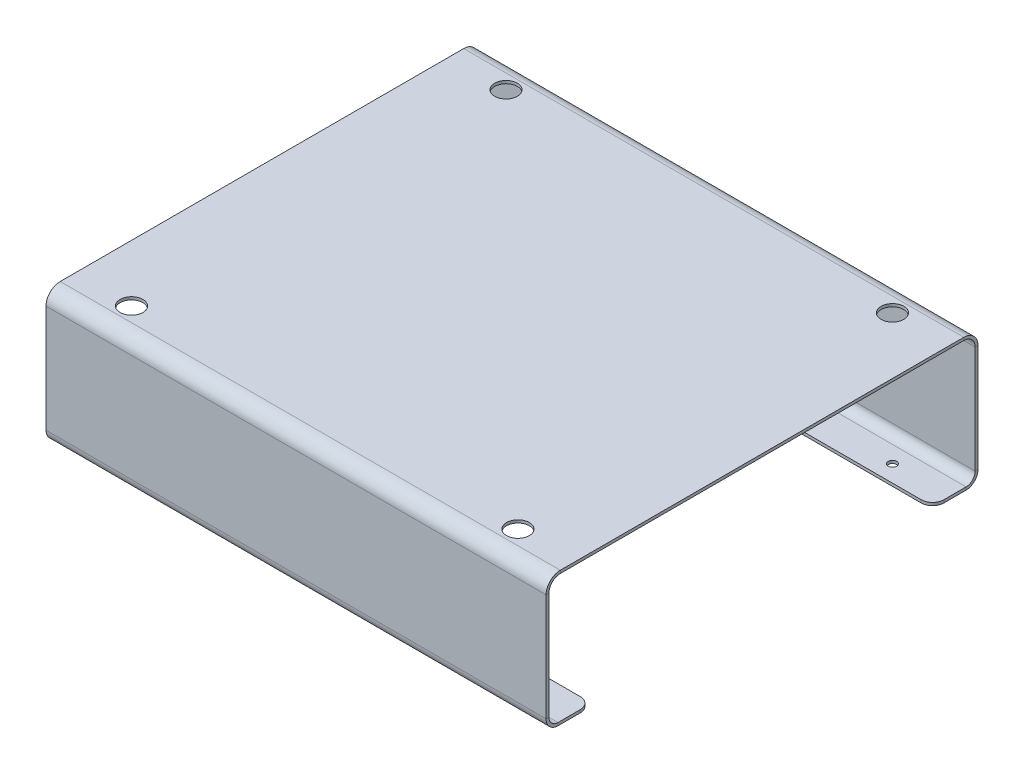
from build123d import *

# Parameters (mm, degrees)
BASE_FLANGE1_DEPTH             = 120.65
BASE_FLANGE1_DEPTH_BACK        = 120.65
SKETCH2_W                      = 279.4
SKETCH2_H                      = 1.5875
EDGE_FLANGE1_STRIP_W           = 19.05
EDGE_FLANGE1_STRIP_H           = 1.5875
EDGE_FLANGE1_STRIP_CUT_DEPTH   = 279.4
EDGE_FLANGE1_STRIP_2_W         = 19.05
EDGE_FLANGE1_STRIP_2_H         = 1.5875
EDGE_FLANGE1_STRIP_CUT_2_DEPTH = 279.4
EDGE_FLANGE1_DEPTH             = 279.4
EDGE_FLANGE1_BEND_DEPTH        = 279.4
EDGE_FLANGE2_STRIP_W           = 16.51
EDGE_FLANGE2_STRIP_H           = 1.5875
EDGE_FLANGE2_STRIP_CUT_DEPTH   = 279.4
EDGE_FLANGE2_STRIP_2_W         = 16.51
EDGE_FLANGE2_STRIP_2_H         = 1.5875
EDGE_FLANGE2_STRIP_CUT_2_DEPTH = 279.4
EDGE_FLANGE2_DEPTH             = 279.4
EDGE_FLANGE2_BEND_DEPTH        = 279.4
FILLET1_R                      = 6.35
SKETCH18_R                     = 2.38125
CUT_EXTRUDE1_DEPTH             = 200.096804736
CUT_EXTRUDE2_REACH             = 201.097
SKETCH19_R                     = 6.35


# Sheet-metal steps are written as plain solids
with BuildPart() as part:
    # Sketch2 → Base-Flange1 (new, two sides: drawn at the far end of the back side and taken through both)
    with BuildSketch(Plane.XY.offset(-BASE_FLANGE1_DEPTH_BACK)):
        with Locations((0, -0.79375)):
            Rectangle(SKETCH2_W, SKETCH2_H)
    extrude(amount=BASE_FLANGE1_DEPTH + BASE_FLANGE1_DEPTH_BACK)

    # Edge-Flange1 strip (across the edge) → Edge-Flange1 strip cut (cut)
    with BuildSketch(Plane(origin=(139.7, -1.5875, 120.65), x_dir=(0, 0, -1), z_dir=(-1, 0, 0))):
        with Locations((-1.5875, -0.79375)):
            Rectangle(EDGE_FLANGE1_STRIP_W, EDGE_FLANGE1_STRIP_H)
    extrude(amount=EDGE_FLANGE1_STRIP_CUT_DEPTH, mode=Mode.SUBTRACT)

    # Edge-Flange1 strip 2 (across the edge) → Edge-Flange1 strip cut 2 (cut)
    with BuildSketch(Plane(origin=(-139.7, -1.5875, -120.65), x_dir=(0, 0, 1), z_dir=(1, 0, 0))):
        with Locations((-1.5875, -0.79375)):
            Rectangle(EDGE_FLANGE1_STRIP_2_W, EDGE_FLANGE1_STRIP_2_H)
    extrude(amount=EDGE_FLANGE1_STRIP_CUT_2_DEPTH, mode=Mode.SUBTRACT)

    # Edge-Flange1 section (across the edge) → Edge-Flange1 (add)
    with BuildSketch(Plane(origin=(139.7, -1.5875, 120.65), x_dir=(0, 0, -1), z_dir=(-1, 0, 0))):
        with BuildLine():
            Line((0, 6.35), (0, 73.025))
            Line((0, 73.025), (1.5875, 73.025))
            Line((1.5875, 73.025), (1.5875, 6.35))
            ThreePointArc((1.5875, 6.35), (3.447371939, 1.859871939), (7.9375, 0))
            Line((7.9375, 0), (7.9375, -1.5875))
            ThreePointArc((7.9375, -1.5875), (2.324839924, 0.737339924), (0, 6.35))
        make_face()
    extrude(amount=EDGE_FLANGE1_DEPTH)

    # Edge-Flange1 section 2 (across the edge) → Edge-Flange1 bend (add)
    with BuildSketch(Plane(origin=(-139.7, -1.5875, -120.65), x_dir=(0, 0, 1), z_dir=(1, 0, 0))):
        with BuildLine():
            Line((0, 6.35), (0, 73.025))
            Line((0, 73.025), (1.5875, 73.025))
            Line((1.5875, 73.025), (1.5875, 6.35))
            ThreePointArc((1.5875, 6.35), (3.447371939, 1.859871939), (7.9375, 0))
            Line((7.9375, 0), (7.9375, -1.5875))
            ThreePointArc((7.9375, -1.5875), (2.324839924, 0.737339924), (0, 6.35))
        make_face()
    extrude(amount=EDGE_FLANGE1_BEND_DEPTH)

    # Edge-Flange2 strip (across the edge) → Edge-Flange2 strip cut (cut)
    with BuildSketch(Plane(origin=(139.7, -74.6125, 119.0625), x_dir=(0, 1, 0), z_dir=(-1, 0, 0))):
        with Locations((-1.5875, -0.79375)):
            Rectangle(EDGE_FLANGE2_STRIP_W, EDGE_FLANGE2_STRIP_H)
    extrude(amount=EDGE_FLANGE2_STRIP_CUT_DEPTH, mode=Mode.SUBTRACT)

    # Edge-Flange2 strip 2 (across the edge) → Edge-Flange2 strip cut 2 (cut)
    with BuildSketch(Plane(origin=(-139.7, -74.6125, -119.0625), x_dir=(0, 1, 0), z_dir=(1, 0, 0))):
        with Locations((-1.5875, -0.79375)):
            Rectangle(EDGE_FLANGE2_STRIP_2_W, EDGE_FLANGE2_STRIP_2_H)
    extrude(amount=EDGE_FLANGE2_STRIP_CUT_2_DEPTH, mode=Mode.SUBTRACT)

    # Edge-Flange2 section (across the edge) → Edge-Flange2 (add)
    with BuildSketch(Plane(origin=(139.7, -74.6125, 119.0625), x_dir=(0, 1, 0), z_dir=(-1, 0, 0))):
        with BuildLine():
            Line((0, 5.08), (0, 23.8125))
            Line((0, 23.8125), (1.5875, 23.8125))
            Line((1.5875, 23.8125), (1.5875, 5.08))
            ThreePointArc((1.5875, 5.08), (3.075397552, 1.487897552), (6.6675, 0))
            Line((6.6675, 0), (6.6675, -1.5875))
            ThreePointArc((6.6675, -1.5875), (1.952865536, 0.365365536), (0, 5.08))
        make_face()
    extrude(amount=EDGE_FLANGE2_DEPTH)

    # Edge-Flange2 section 2 (across the edge) → Edge-Flange2 bend (add)
    with BuildSketch(Plane(origin=(-139.7, -74.6125, -119.0625), x_dir=(0, 1, 0), z_dir=(1, 0, 0))):
        with BuildLine():
            Line((0, 5.08), (0, 23.8125))
            Line((0, 23.8125), (1.5875, 23.8125))
            Line((1.5875, 23.8125), (1.5875, 5.08))
            ThreePointArc((1.5875, 5.08), (3.075397552, 1.487897552), (6.6675, 0))
            Line((6.6675, 0), (6.6675, -1.5875))
            ThreePointArc((6.6675, -1.5875), (1.952865536, 0.365365536), (0, 5.08))
        make_face()
    extrude(amount=EDGE_FLANGE2_BEND_DEPTH)

    # Fillet1
    fillet1_edges = [part.edges().sort_by_distance(p)[0] for p in [
        (139.7, -73.81875, 95.25),
        (-139.7, -73.81875, 95.25),
        (-139.7, -73.81875, -95.25),
        (139.7, -73.81875, -95.25),
    ]]
    fillet(fillet1_edges, radius=FILLET1_R)

    # Sketch18 → Cut-Extrude1 (cut, through all)
    with BuildSketch(Plane.XZ.offset(74.6125)):
        with Locations(Location((-107.95, 104.61625, 0), (0, 0, 270))):
            Circle(SKETCH18_R)
        with Locations(Location((-107.95, -104.61625, 0), (0, 0, 270))):
            Circle(SKETCH18_R)
        with Locations(Location((107.95, -104.61625, 0), (0, 0, 270))):
            Circle(SKETCH18_R)
        with Locations(Location((107.95, 104.61625, 0), (0, 0, 270))):
            Circle(SKETCH18_R)
    extrude(amount=-CUT_EXTRUDE1_DEPTH, mode=Mode.SUBTRACT)

    # Sketch19 → Cut-Extrude2 (cut, up to next)
    with BuildSketch(Plane(origin=(0, 0, 0), x_dir=(1, 0, 0), z_dir=(0, 1, 0)), mode=Mode.PRIVATE) as cut_extrude2_sk1:
        with Locations(Location((-107.95, -104.61625, 0), (0, 0, 180))):
            Circle(SKETCH19_R)
    cut_extrude2_tool1 = extrude(cut_extrude2_sk1.sketch, amount=-CUT_EXTRUDE2_REACH, mode=Mode.PRIVATE) & part.part
    # Sketch19 → Cut-Extrude2 (cut, up to next)
    with BuildSketch(Plane(origin=(0, 0, 0), x_dir=(1, 0, 0), z_dir=(0, 1, 0)), mode=Mode.PRIVATE) as cut_extrude2_sk2:
        with Locations(Location((107.95, -104.61625, 0), (0, 0, 180))):
            Circle(SKETCH19_R)
    cut_extrude2_tool2 = extrude(cut_extrude2_sk2.sketch, amount=-CUT_EXTRUDE2_REACH, mode=Mode.PRIVATE) & part.part
    # Sketch19 → Cut-Extrude2 (cut, up to next)
    with BuildSketch(Plane(origin=(0, 0, 0), x_dir=(1, 0, 0), z_dir=(0, 1, 0)), mode=Mode.PRIVATE) as cut_extrude2_sk3:
        with Locations(Location((107.95, 104.61625, 0), (0, 0, 180))):
            Circle(SKETCH19_R)
    cut_extrude2_tool3 = extrude(cut_extrude2_sk3.sketch, amount=-CUT_EXTRUDE2_REACH, mode=Mode.PRIVATE) & part.part
    # Sketch19 → Cut-Extrude2 (cut, up to next)
    with BuildSketch(Plane(origin=(0, 0, 0), x_dir=(1, 0, 0), z_dir=(0, 1, 0)), mode=Mode.PRIVATE) as cut_extrude2_sk4:
        with Locations(Location((-107.95, 104.61625, 0), (0, 0, 180))):
            Circle(SKETCH19_R)
    cut_extrude2_tool4 = extrude(cut_extrude2_sk4.sketch, amount=-CUT_EXTRUDE2_REACH, mode=Mode.PRIVATE) & part.part
    add(cut_extrude2_tool1.solids().sort_by_distance((-107.95, 0, 104.61625))[0], mode=Mode.SUBTRACT)
    add(cut_extrude2_tool2.solids().sort_by_distance((107.95, 0, 104.61625))[0], mode=Mode.SUBTRACT)
    add(cut_extrude2_tool3.solids().sort_by_distance((107.95, 0, -104.61625))[0], mode=Mode.SUBTRACT)
    add(cut_extrude2_tool4.solids().sort_by_distance((-107.95, 0, -104.61625))[0], mode=Mode.SUBTRACT)


solid = part.part
